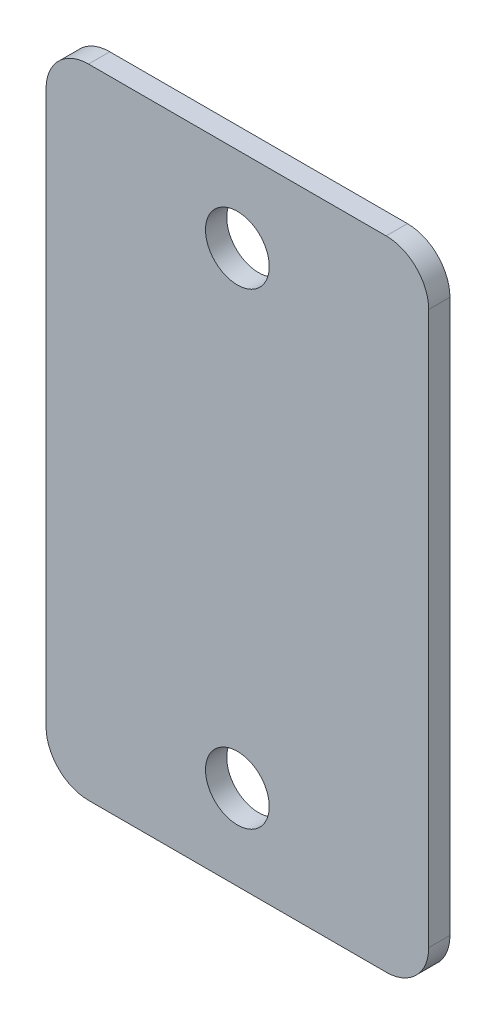
from build123d import *

# Parameters (mm, degrees)
SKETCH1_W             = 36
SKETCH1_H             = 60
BOSS_EXTRUDE1_DEPTH   = 1
F_6_0MM_DOWEL_HOLE1_D = 6
FILLET1_R             = 4


with BuildPart() as part:
    # Sketch1 → Boss-Extrude1 (new, symmetric)
    with BuildSketch(Plane.XY):
        Rectangle(SKETCH1_W, SKETCH1_H)
    extrude(amount=BOSS_EXTRUDE1_DEPTH, both=True)

    # Ø6.0mm Dowel Hole1 (through all)
    with Locations(Plane.XY.offset(1)):
        with Locations((0, 22), (0, -22)):
            Hole(F_6_0MM_DOWEL_HOLE1_D / 2)

    # Fillet1
    fillet1_edges = [part.edges().sort_by_distance(p)[0] for p in [
        (18, -30, 0),
        (-18, -30, 0),
        (18, 30, 0),
        (-18, 30, 0),
    ]]
    fillet(fillet1_edges, radius=FILLET1_R)


solid = part.part
